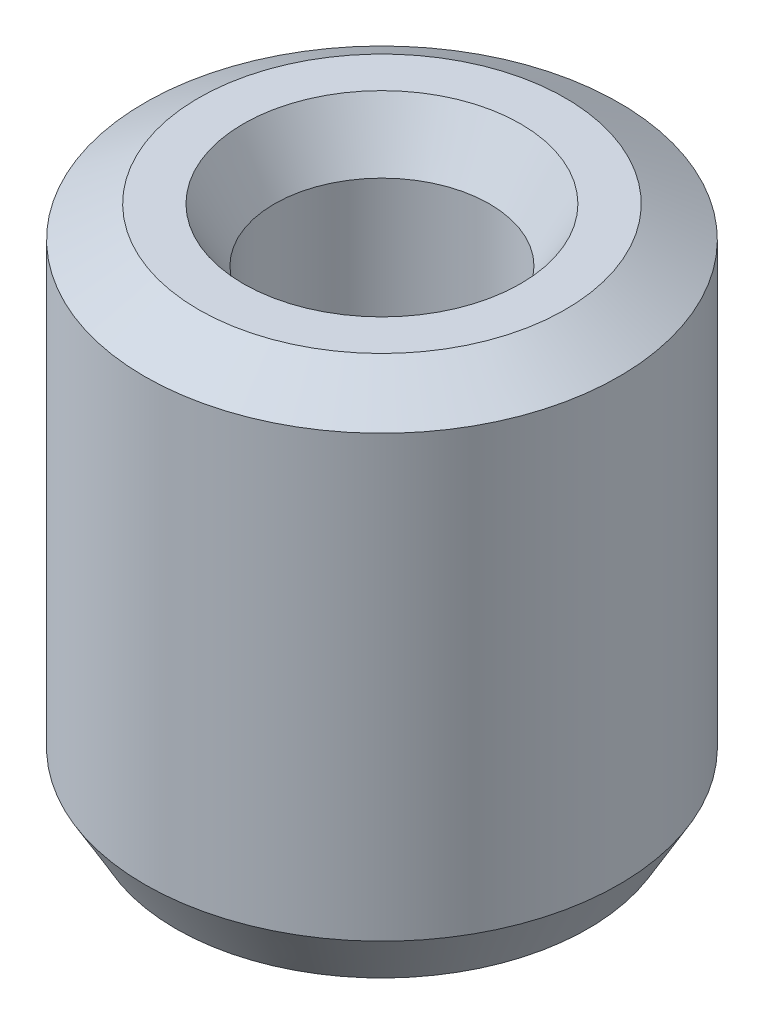
from build123d import *
from OCP.BRepFilletAPI import BRepFilletAPI_MakeChamfer

# Parameters (mm, degrees)
SKETCH1_R           = 7.5
BOSS_EXTRUDE1_DEPTH = 16.595119403
SKETCH2_R           = 3.40004055
CUT_EXTRUDE1_DEPTH  = 20.695125996
CHAMFER1_SIZE       = 0.982378106
CHAMFER1_SIZE2      = 1.701528791


with BuildPart() as part:
    # Sketch1 → Boss-Extrude1 (new body)
    with BuildSketch(Plane(origin=(0, 0, 0), x_dir=(1, 0, 0), z_dir=(0, 1, 0))):
        Circle(SKETCH1_R)
    extrude(amount=BOSS_EXTRUDE1_DEPTH)

    # Sketch2 → Cut-Extrude1 (cut, through all)
    with BuildSketch(Plane(origin=(0, 0, 0), x_dir=(1, 0, 0), z_dir=(0, 1, 0))):
        Circle(SKETCH2_R)
    extrude(amount=CUT_EXTRUDE1_DEPTH, mode=Mode.SUBTRACT)

    # Chamfer1: one chamfer whose edges measure the first distance from different faces: ONE call of the kernel's chamfer builder (chamfer() names one face for all edges)
    chamfer1_edges_1 = [part.edges().sort_by_distance(p)[0] for p in [
        (-3.40004055, 16.595119403, 0),
    ]]
    chamfer1_side_1 = [part.faces().sort_by_distance(p)[0] for p in [
        (-7.287867966, 16.595119403, 0),
    ]]
    chamfer1_edges_2 = [part.edges().sort_by_distance(p)[0] for p in [
        (-3.40004055, 0, 0),
    ]]
    chamfer1_side_2 = [part.faces().sort_by_distance(p)[0] for p in [
        (-3.40004055, 8.297559701, 0),
    ]]
    chamfer1_edges_3 = [part.edges().sort_by_distance(p)[0] for p in [
        (-7.5, 0, 0),
    ]]
    chamfer1_side_3 = [part.faces().sort_by_distance(p)[0] for p in [
        (-7.287867966, 0, 0),
    ]]
    chamfer1_edges_4 = [part.edges().sort_by_distance(p)[0] for p in [
        (-7.5, 16.595119403, 0),
    ]]
    chamfer1_side_4 = [part.faces().sort_by_distance(p)[0] for p in [
        (-7.5, 8.297559701, 0),
    ]]
    chamfer1 = BRepFilletAPI_MakeChamfer(part.part.solid().wrapped)
    for e in chamfer1_edges_1:
        chamfer1.Add(CHAMFER1_SIZE, CHAMFER1_SIZE2, e.wrapped, chamfer1_side_1[0].wrapped)  # the first distance lies on this face
    for e in chamfer1_edges_2:
        chamfer1.Add(CHAMFER1_SIZE, CHAMFER1_SIZE2, e.wrapped, chamfer1_side_2[0].wrapped)  # the first distance lies on this face
    for e in chamfer1_edges_3:
        chamfer1.Add(CHAMFER1_SIZE, CHAMFER1_SIZE2, e.wrapped, chamfer1_side_3[0].wrapped)  # the first distance lies on this face
    for e in chamfer1_edges_4:
        chamfer1.Add(CHAMFER1_SIZE, CHAMFER1_SIZE2, e.wrapped, chamfer1_side_4[0].wrapped)  # the first distance lies on this face
    add(Compound.cast(chamfer1.Shape()), mode=Mode.REPLACE)


solid = part.part
